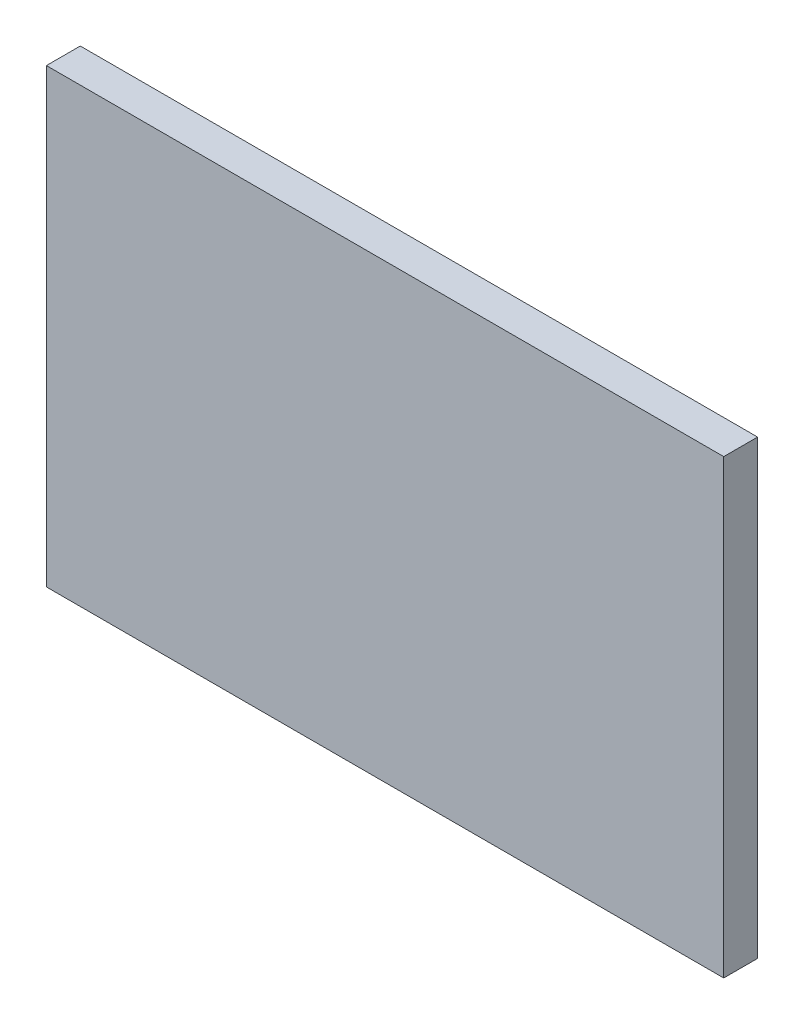
from build123d import *

# Parameters (mm, degrees)
ESBO_O1_W                = 60
ESBO_O1_H                = 40
RESSALTO_EXTRUS_O1_DEPTH = 3


with BuildPart() as part:
    # Esboço1 → Ressalto-extrusão1 (new body)
    with BuildSketch(Plane.XY):
        with Locations((30, 20)):
            Rectangle(ESBO_O1_W, ESBO_O1_H)
    extrude(amount=RESSALTO_EXTRUS_O1_DEPTH)


solid = part.part
